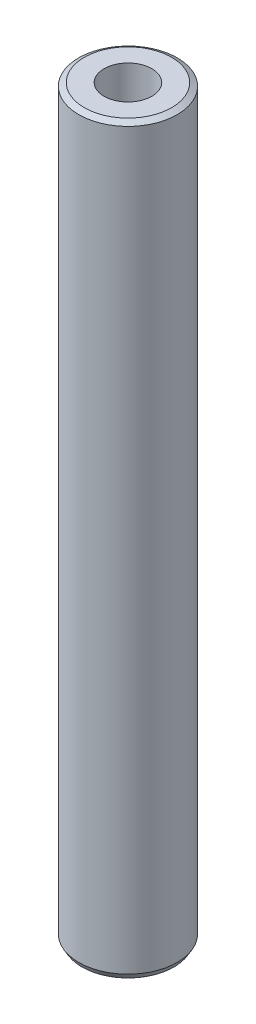
from build123d import *
from OCP.BRepFilletAPI import BRepFilletAPI_MakeChamfer

# Parameters (mm, degrees)
SKETCH1_R           = 37.5
BOSS_EXTRUDE1_DEPTH = 565.740862058
SKETCH2_R           = 18.204947619
CUT_EXTRUDE1_DEPTH  = 569.221103975
CHAMFER1_SIZE       = 2.457000209
CHAMFER1_SIZE2      = 4.255649197


with BuildPart() as part:
    # Sketch1 → Boss-Extrude1 (new body)
    with BuildSketch(Plane(origin=(0, 0, 0), x_dir=(1, 0, 0), z_dir=(0, 1, 0))):
        Circle(SKETCH1_R)
    extrude(amount=BOSS_EXTRUDE1_DEPTH)

    # Sketch2 → Cut-Extrude1 (cut, through all)
    with BuildSketch(Plane(origin=(0, 0, 0), x_dir=(1, 0, 0), z_dir=(0, 1, 0))):
        Circle(SKETCH2_R)
    extrude(amount=CUT_EXTRUDE1_DEPTH, mode=Mode.SUBTRACT)

    # Chamfer1: one chamfer whose edges measure the first distance from different faces: ONE call of the kernel's chamfer builder (chamfer() names one face for all edges)
    chamfer1_edges_1 = [part.edges().sort_by_distance(p)[0] for p in [
        (-37.5, 565.740862058, 0),
    ]]
    chamfer1_side_1 = [part.faces().sort_by_distance(p)[0] for p in [
        (-37.5, 282.870431029, 0),
    ]]
    chamfer1_edges_2 = [part.edges().sort_by_distance(p)[0] for p in [
        (-37.5, 0, 0),
    ]]
    chamfer1_side_2 = [part.faces().sort_by_distance(p)[0] for p in [
        (-36.439339828, 0, 0),
    ]]
    chamfer1 = BRepFilletAPI_MakeChamfer(part.part.solid().wrapped)
    for e in chamfer1_edges_1:
        chamfer1.Add(CHAMFER1_SIZE, CHAMFER1_SIZE2, e.wrapped, chamfer1_side_1[0].wrapped)  # the first distance lies on this face
    for e in chamfer1_edges_2:
        chamfer1.Add(CHAMFER1_SIZE, CHAMFER1_SIZE2, e.wrapped, chamfer1_side_2[0].wrapped)  # the first distance lies on this face
    add(Compound.cast(chamfer1.Shape()), mode=Mode.REPLACE)


solid = part.part
